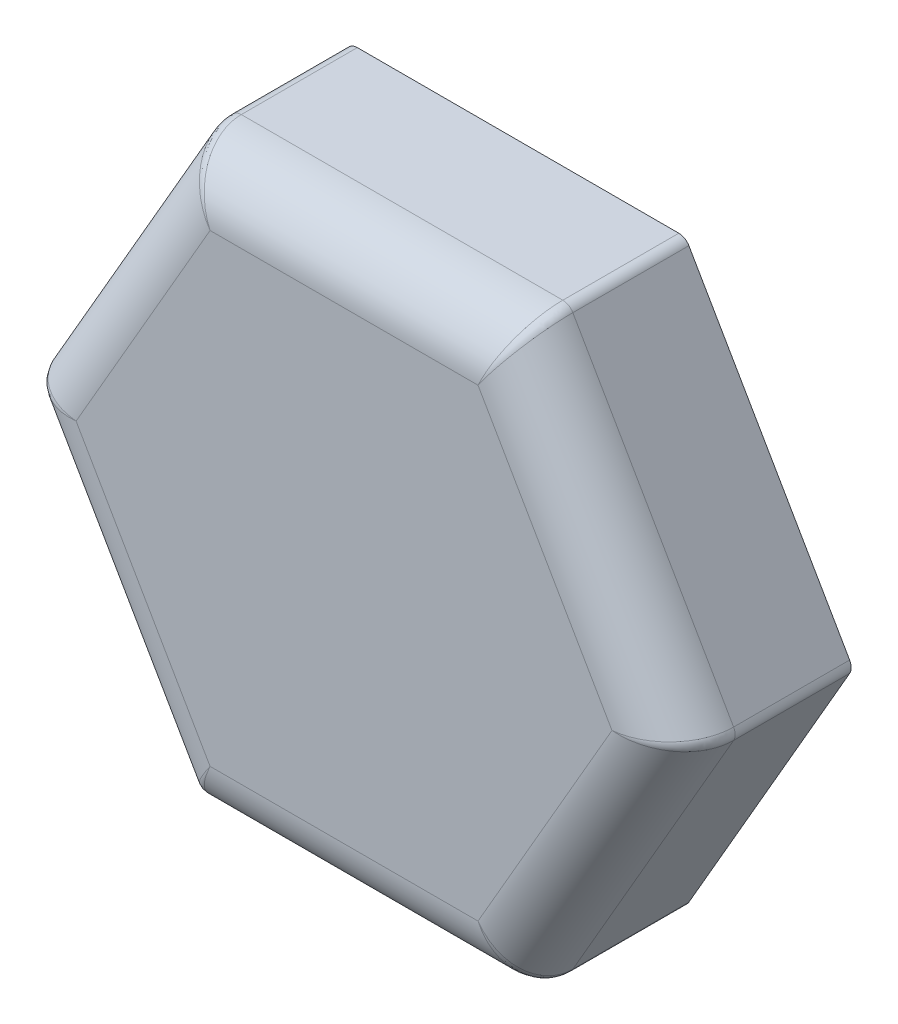
from build123d import *

# Parameters (mm, degrees)
DODANIE_WYCI_GNI_CIE1_DEPTH = 15
ZAOKR_GLENIE1_R             = 5
ZAOKR_GLENIE2_R             = 1
SZKIC3_R                    = 11.5
DODANIE_WYCI_GNI_CIE2_DEPTH = 6


with BuildPart() as part:
    # Szkic1 → Dodanie-wyciągnięcie1 (new body)
    with BuildSketch(Plane.XY):
        Polygon((14.43375673, -25), (28.867513459, 0), (14.43375673, 25), (-14.43375673, 25), (-28.867513459, 0), (-14.43375673, -25), align=None)
    extrude(amount=DODANIE_WYCI_GNI_CIE1_DEPTH)

    # Zaokrąglenie1
    zaokr_glenie1_edges = [part.edges().sort_by_distance(p)[0] for p in [
        (0, 25, 15),
        (-21.650635095, 12.5, 15),
        (-21.650635095, -12.5, 15),
        (0, -25, 15),
        (21.650635095, -12.5, 15),
        (21.650635095, 12.5, 15),
    ]]
    fillet(zaokr_glenie1_edges, radius=ZAOKR_GLENIE1_R)

    # Zaokrąglenie2
    zaokr_glenie2_edges = [part.edges().sort_by_distance(p)[0] for p in [
        (-13.514121691, 23.407145389, 13.65942076),
        (-27.02824329, 0, 13.659420835),
        (-13.514121691, -23.407145389, 13.65942076),
        (13.514121691, -23.407145389, 13.65942076),
        (27.028243383, 0, 13.65942076),
        (13.514121691, 23.407145389, 13.65942076),
        (-14.43375673, 25, 5),
        (-28.867513459, 0, 5),
        (-14.43375673, -25, 5),
        (14.43375673, -25, 5),
        (28.867513459, 0, 5),
        (14.43375673, 25, 5),
    ]]
    fillet(zaokr_glenie2_edges, radius=ZAOKR_GLENIE2_R)

    # Szkic3 → Dodanie-wyciągnięcie2 (add)
    with BuildSketch(Plane(origin=(0, 0, 0), x_dir=(-1, 0, 0), z_dir=(0, 0, -1))):
        Circle(SZKIC3_R)
        Polygon((4.907477288, -8.5), (9.814954576, 0), (4.907477288, 8.5), (-4.907477288, 8.5), (-9.814954576, 0), (-4.907477288, -8.5), align=None, mode=Mode.SUBTRACT)
    extrude(amount=DODANIE_WYCI_GNI_CIE2_DEPTH)


solid = part.part
